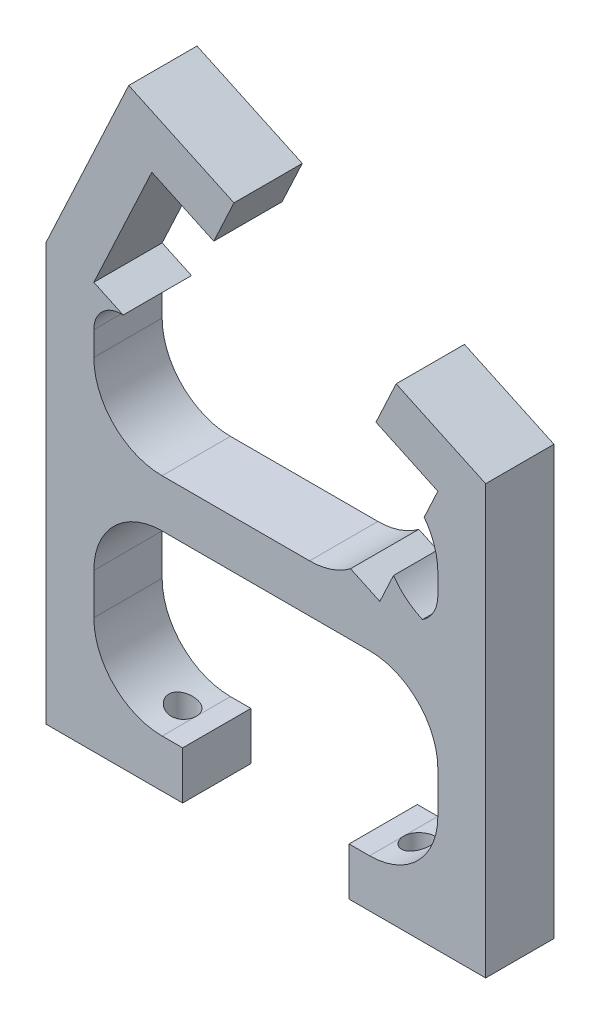
from build123d import *

# Parameters (mm, degrees)
SALIENTE_EXTRUIR1_DEPTH = 10
REDONDEO1_R             = 10
REDONDEO2_R             = 10
CROQUIS2_R              = 2
CORTAR_EXTRUIR1_DEPTH   = 10


with BuildPart() as part:
    # Croquis1 → Saliente-Extruir1 (new body)
    with BuildSketch(Plane.XY):
        with BuildLine():
            Line((-15.183023411, 0), (15.183023411, 0))
            ThreePointArc((15.183023411, 0), (22.254091223, -2.928932188), (25.183023411, -10))
            Line((25.183023411, -10), (25.183023411, -16))
            ThreePointArc((25.183023411, -16), (22.254091223, -23.071067812), (15.183023411, -26))
            Line((15.183023411, -26), (12.183023411, -26))
            Line((12.183023411, -26), (12.183023411, -33))
            Line((12.183023411, -33), (25.183023411, -33))
            Line((25.183023411, -33), (32.183023411, -33))
            Line((32.183023411, -33), (32.183023411, 7))
            Line((32.183023411, 7), (32.183023411, 29.676278345))
            Line((32.183023411, 29.676278345), (19.078273373, 35.787123646))
            Line((19.078273373, 35.787123646), (16.119945541, 29.442969137))
            Line((16.119945541, 29.442969137), (25.183023411, 25.216786519))
            Line((25.183023411, 25.216786519), (23.183023411, 20.927772678))
            Line((23.183023411, 20.927772678), (25.183023411, 20.927772678))
            Line((25.183023411, 20.927772678), (25.183023411, 12))
            ThreePointArc((25.183023411, 12), (23.718557317, 8.464466094), (20.183023411, 7))
            Line((20.183023411, 7), (18.68839635, 7))
            Line((18.68839635, 7), (18.68839635, 11.289013841))
            Line((18.68839635, 11.289013841), (16.68839635, 7))
            Line((16.68839635, 7), (12.399382509, 9))
            Line((12.399382509, 9), (12.399382509, 7))
            Line((12.399382509, 7), (-15.183023411, 7))
            ThreePointArc((-15.183023411, 7), (-22.254091223, 9.928932188), (-25.183023411, 17))
            Line((-25.183023411, 17), (-25.183023411, 20.524963692))
            ThreePointArc((-25.183023411, 20.524963692), (-24.011450536, 23.353390817), (-21.183023411, 24.524963692))
            Line((-21.183023411, 24.524963692), (-20.89400957, 24.524963692))
            Line((-20.89400957, 24.524963692), (-25.183023411, 26.524963692))
            Line((-25.183023411, 26.524963692), (-16.68839635, 44.741750212))
            Line((-16.68839635, 44.741750212), (-7.62531848, 40.515567594))
            Line((-7.62531848, 40.515567594), (-4.666990648, 46.859722104))
            Line((-4.666990648, 46.859722104), (-20.074223027, 54.044232553))
            Line((-20.074223027, 54.044232553), (-32.183023411, 28.076826331))
            Line((-32.183023411, 28.076826331), (-32.183023411, 7))
            Line((-32.183023411, 7), (-32.183023411, -33))
            Line((-32.183023411, -33), (-25.183023411, -33))
            Line((-25.183023411, -33), (-12.183023411, -33))
            Line((-12.183023411, -33), (-12.183023411, -26))
            Line((-12.183023411, -26), (-15.183023411, -26))
            ThreePointArc((-15.183023411, -26), (-22.254091223, -23.071067812), (-25.183023411, -16))
            Line((-25.183023411, -16), (-25.183023411, -10))
            ThreePointArc((-25.183023411, -10), (-22.254091223, -2.928932188), (-15.183023411, 0))
        make_face()
    extrude(amount=SALIENTE_EXTRUIR1_DEPTH)

    # Redondeo1
    # the kernel refuses this fillet: 10 mm, written as the material it adds along each edge
    with BuildSketch(Plane(origin=(18.68839635, 7, 0), x_dir=(0, 1, 0), z_dir=(0, 0, 1))) as redondeo1_piece_1_section:
        with BuildLine():
            CenterArc((10, -8.208814597), REDONDEO1_R, 124.826871163, 55.173128837)
            Line((0, -8.208814597), (-0.2, -8.208814597))
            Line((-0.2, -8.208814597), (-0.2, 0))
            Line((-0.2, 0), (0, 0.2))
            ThreePointArc((0, 0.2), (2.144506921, 0.2), (4.174794118, 0.164176292))
            Line((4.174794118, 0.164176292), (4.289013841, 0))
        make_face()
    redondeo1_piece_1 = extrude(amount=10, mode=Mode.PRIVATE)
    redondeo1_piece_1 = split(redondeo1_piece_1, bisect_by=Plane(origin=(17.840933122, 9.471623083, 5), z_dir=(0.9063077870366527, -0.4226182617406938, 0)), keep=Keep.TOP, mode=Mode.PRIVATE)
    add(redondeo1_piece_1)
    with BuildSketch(Plane(origin=(12.399382509, 7, 0), x_dir=(-1, 0, 0), z_dir=(0, 0, 1))) as redondeo1_piece_2:
        with BuildLine():
            CenterArc((6, -10), REDONDEO1_R, 90, 36.869897646)
            Line((0, -2), (-0.12, -1.84))
            ThreePointArc((-0.12, -1.84), (-0.2, -1), (-0.2, 0))
            Line((-0.2, 0), (0, 0.2))
            Line((0, 0.2), (6, 0.2))
            Line((6, 0.2), (6, 0))
        make_face()
    extrude(amount=10)

    # Redondeo2
    # the kernel refuses this fillet: 10 mm, written as the material it adds along each edge
    with BuildSketch(Plane(origin=(25.183023411, 20.927772678, 0), x_dir=(-1, 0, 0), z_dir=(0, 0, 1))) as redondeo2_piece_1:
        with BuildLine():
            CenterArc((10, 6), REDONDEO2_R, 180, 36.869897646)
            Line((0, 6), (-0.2, 6))
            Line((-0.2, 6), (-0.2, 0))
            Line((-0.2, 0), (0, -0.2))
            ThreePointArc((0, -0.2), (1, -0.2), (1.84, -0.12))
            Line((1.84, -0.12), (2, 0))
        make_face()
    extrude(amount=10)

    # Croquis2 → Cortar-Extruir1 (cut)
    with BuildSketch(Plane.XZ.offset(33)):
        with Locations(Location((-17.183023411, 5, 0), (0, 0, 270))):
            Circle(CROQUIS2_R)
        with Locations(Location((17.183023411, 5, 0), (0, 0, 270))):
            Circle(CROQUIS2_R)
    extrude(amount=-CORTAR_EXTRUIR1_DEPTH, mode=Mode.SUBTRACT)


solid = part.part
